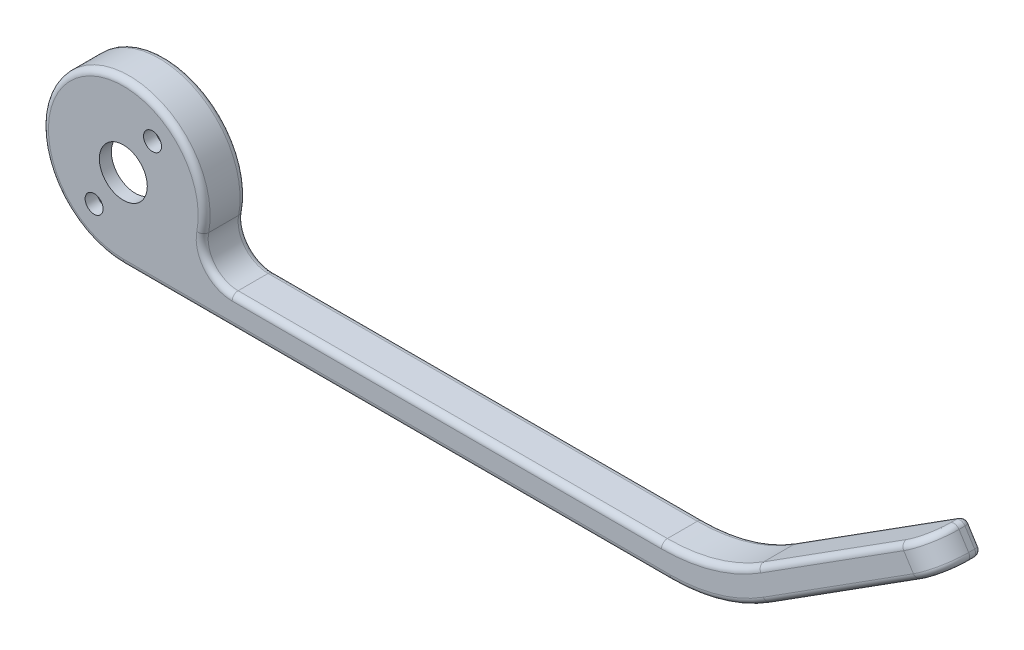
from build123d import *

# Parameters (mm, degrees)
ESQUISSE1_R             = 4
BOSS_EXTRU_1_DEPTH      = 3.5
CONG_1_R                = 5
ENL_V_START             = -2
ESQUISSE5_R             = 12.25
ENL_V_MAT_EXTRU_3_DEPTH = 136.544040158
ESQUISSE6_R             = 1.5
ENL_V_MAT_EXTRU_4_DEPTH = 138.544040158
CONG_3_R                = 30
CONG_2_R                = 1


with BuildPart() as part:
    # Esquisse1 → Boss.-Extru.1 (new, symmetric)
    with BuildSketch(Plane.XY):
        with BuildLine():
            Line((10.488088482, -8.5), (98.546295751, -8.5))
            Line((98.546295751, -8.5), (133.969714184, 14))
            Line((133.969714184, 14), (136.650514024, 9.779418024))
            Line((136.650514024, 9.779418024), (100, -13.5))
            Line((100, -13.5), (0, -13.5))
            ThreePointArc((0, -13.5), (-5.809475019, 12.186057607), (10.488088482, -8.5))
        make_face()
        Circle(ESQUISSE1_R, mode=Mode.SUBTRACT)
    extrude(amount=BOSS_EXTRU_1_DEPTH, both=True)

    # Congé1
    cong_1_edges = [part.edges().sort_by_distance(p)[0] for p in [
        (10.488088482, -8.5, 0),
        (135.310114104, 11.889709012, 3.5),
    ]]
    fillet(cong_1_edges, radius=CONG_1_R)

    # Esquisse5 → Enlèv. mat.-Extru.3 (cut, through all)
    with BuildSketch(Plane.XY.offset(3.5).offset(ENL_V_START)):
        Circle(ESQUISSE5_R)
    extrude(amount=-ENL_V_MAT_EXTRU_3_DEPTH, mode=Mode.SUBTRACT)

    # Esquisse6 → Enlèv. mat.-Extru.4 (cut, through all)
    with BuildSketch(Plane.XY.offset(3.5)):
        with Locations((4.875399709, 6.962792376)):
            Circle(ESQUISSE6_R)
        with Locations((-4.875399709, -6.962792376)):
            Circle(ESQUISSE6_R)
    extrude(amount=-ENL_V_MAT_EXTRU_4_DEPTH, mode=Mode.SUBTRACT)

    # Congé3
    cong_3_edges = [part.edges().sort_by_distance(p)[0] for p in [
        (100, -13.5, 0),
        (98.546295751, -8.5, 0),
    ]]
    fillet(cong_3_edges, radius=CONG_3_R)

    # Congé2
    cong_2_edges = [part.edges().sort_by_distance(p)[0] for p in [
        (53.99498619, -8.5, 3.5),
        (45.638887252, -13.5, 3.5),
        (53.99498619, -8.5, -3.5),
        (45.638887252, -13.5, -3.5),
        (-8.59564629, 10.409844613, 3.5),
        (-8.59564629, 10.409844613, -3.5),
        (117.829000751, 3.747854151, 3.5),
        (98.199487984, -7.307158448, 3.5),
        (119.896252796, -0.862436837, 3.5),
        (99.653192234, -12.307158448, 3.5),
        (119.93929174, 5.088254071, -3.5),
        (98.199487984, -7.307158448, -3.5),
        (122.006543784, 0.477963083, -3.5),
        (99.653192234, -12.307158448, -3.5),
        (136.650514024, 9.779418024, -2.5),
        (133.969714184, 14, -2.5),
        (135.310114104, 11.889709012, -3.5),
        (14.31040412, -6.6835727, -3.5),
        (14.31040412, -6.6835727, 3.5),
        (132.733534344, 13.214811906, 2.035533906),
        (135.414334184, 8.99422993, 2.035533906),
    ]]
    fillet(cong_2_edges, radius=CONG_2_R)


solid = part.part
